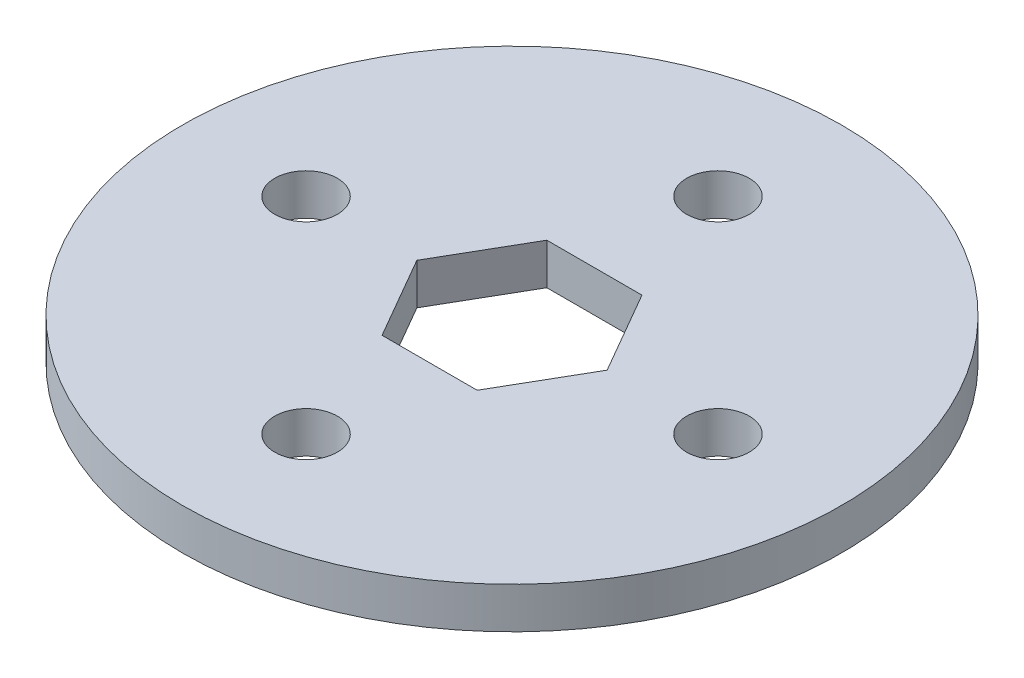
from build123d import *

# Parameters (mm, degrees)
SKETCH1_R           = 25.4
SKETCH1_R_2         = 2.413
BOSS_EXTRUDE1_DEPTH = 3.175


with BuildPart() as part:
    # Sketch1 → Boss-Extrude1 (new body)
    with BuildSketch(Plane(origin=(0, 0, 0), x_dir=(1, 0, 0), z_dir=(0, 1, 0))):
        Circle(SKETCH1_R)
        with Locations((0, 15.875)):
            Circle(SKETCH1_R_2, mode=Mode.SUBTRACT)
        with Locations((15.875, 0)):
            Circle(SKETCH1_R_2, mode=Mode.SUBTRACT)
        with Locations((0, -15.875)):
            Circle(SKETCH1_R_2, mode=Mode.SUBTRACT)
        with Locations((-15.875, 0)):
            Circle(SKETCH1_R_2, mode=Mode.SUBTRACT)
        Polygon((-7.332348419, 0), (-3.666174209, -6.35), (3.666174209, -6.35), (7.332348419, 0), (3.666174209, 6.35), (-3.666174209, 6.35), align=None, mode=Mode.SUBTRACT)
    extrude(amount=BOSS_EXTRUDE1_DEPTH)


solid = part.part
